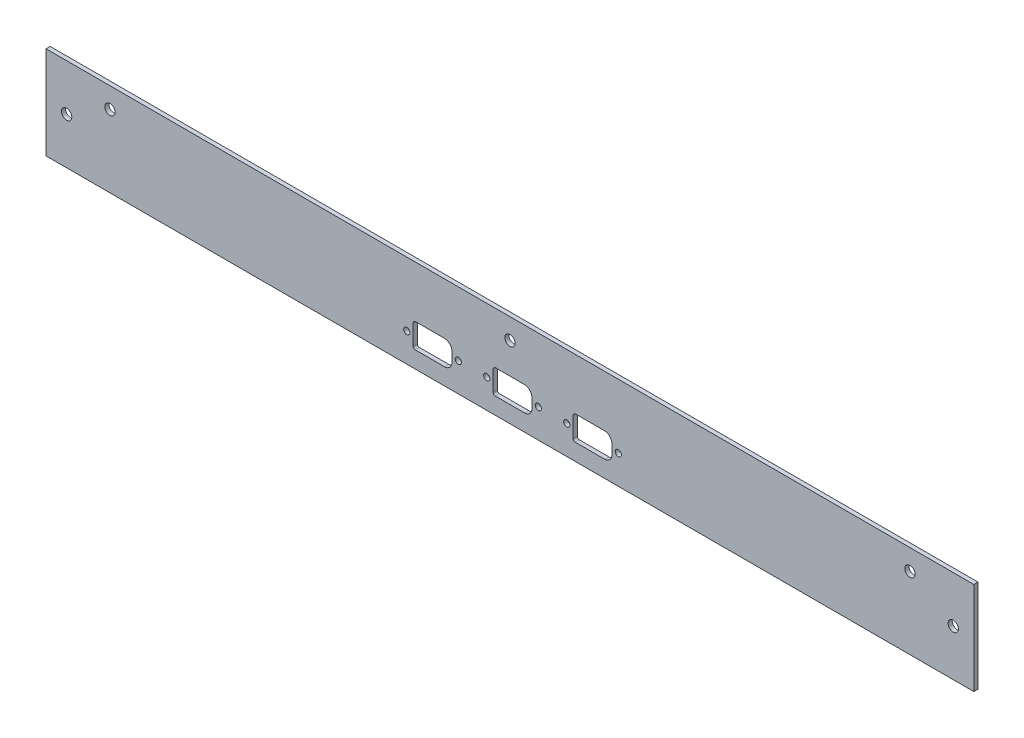
from build123d import *

# Parameters (mm, degrees)
SKETCH1_W           = 450
SKETCH1_H           = 45
BOSS_EXTRUDE1_DEPTH = 2
SKETCH2_R           = 1.5
CUT_EXTRUDE1_DEPTH  = 227.131046077
SKETCH3_R           = 2.5
CUT_EXTRUDE2_DEPTH  = 227.131046077


with BuildPart() as part:
    # Sketch1 → Boss-Extrude1 (new body)
    with BuildSketch(Plane.XY):
        Rectangle(SKETCH1_W, SKETCH1_H)
    extrude(amount=BOSS_EXTRUDE1_DEPTH)

    # Sketch2 → Cut-Extrude1 (cut, through all)
    with BuildSketch(Plane.XY.offset(2)):
        with Locations((-50.0375, -8.55)):
            Circle(SKETCH2_R)
        with Locations((-25.0375, -8.55)):
            Circle(SKETCH2_R)
        with Locations((-11.2375, -8.55)):
            Circle(SKETCH2_R)
        with Locations((13.7625, -8.55)):
            Circle(SKETCH2_R)
        with Locations((27.5625, -8.55)):
            Circle(SKETCH2_R)
        with Locations((52.5625, -8.55)):
            Circle(SKETCH2_R)
        with BuildLine():
            Line((-31.6625, -14.4), (-45.9375, -14.4))
            ThreePointArc((-45.9375, -14.4), (-46.644606781, -14.107106781), (-46.9375, -13.4))
            Line((-46.9375, -13.4), (-46.9375, -3.7))
            ThreePointArc((-46.9375, -3.7), (-46.586028137, -2.851471863), (-45.7375, -2.5))
            Line((-45.7375, -2.5), (-31.8625, -2.5))
            ThreePointArc((-31.8625, -2.5), (-29.22852724, -3.59102724), (-28.1375, -6.225))
            Line((-28.1375, -6.225), (-28.1375, -10.875))
            ThreePointArc((-28.1375, -10.875), (-29.169948596, -13.367551404), (-31.6625, -14.4))
        make_face()
        with BuildLine():
            Line((7.1375, -14.4), (-7.1375, -14.4))
            ThreePointArc((-7.1375, -14.4), (-7.844606781, -14.107106781), (-8.1375, -13.4))
            Line((-8.1375, -13.4), (-8.1375, -3.7))
            ThreePointArc((-8.1375, -3.7), (-7.786028137, -2.851471863), (-6.9375, -2.5))
            Line((-6.9375, -2.5), (6.9375, -2.5))
            ThreePointArc((6.9375, -2.5), (9.57147276, -3.59102724), (10.6625, -6.225))
            Line((10.6625, -6.225), (10.6625, -10.875))
            ThreePointArc((10.6625, -10.875), (9.630051404, -13.367551404), (7.1375, -14.4))
        make_face()
        with BuildLine():
            Line((45.9375, -14.4), (31.6625, -14.4))
            ThreePointArc((31.6625, -14.4), (30.955393219, -14.107106781), (30.6625, -13.4))
            Line((30.6625, -13.4), (30.6625, -3.7))
            ThreePointArc((30.6625, -3.7), (31.013971863, -2.851471863), (31.8625, -2.5))
            Line((31.8625, -2.5), (45.7375, -2.5))
            ThreePointArc((45.7375, -2.5), (48.37147276, -3.59102724), (49.4625, -6.225))
            Line((49.4625, -6.225), (49.4625, -10.875))
            ThreePointArc((49.4625, -10.875), (48.430051404, -13.367551404), (45.9375, -14.4))
        make_face()
    extrude(amount=-CUT_EXTRUDE1_DEPTH, mode=Mode.SUBTRACT)

    # Sketch3 → Cut-Extrude2 (cut, through all)
    with BuildSketch(Plane.XY.offset(2)):
        with Locations((-215, 0)):
            Circle(SKETCH3_R)
        with Locations((215, 0)):
            Circle(SKETCH3_R)
        with Locations((-194, 12.495407459)):
            Circle(SKETCH3_R)
        with Locations((194, 12.495407459)):
            Circle(SKETCH3_R)
        with Locations((0, 12.5)):
            Circle(SKETCH3_R)
    extrude(amount=-CUT_EXTRUDE2_DEPTH, mode=Mode.SUBTRACT)


solid = part.part
